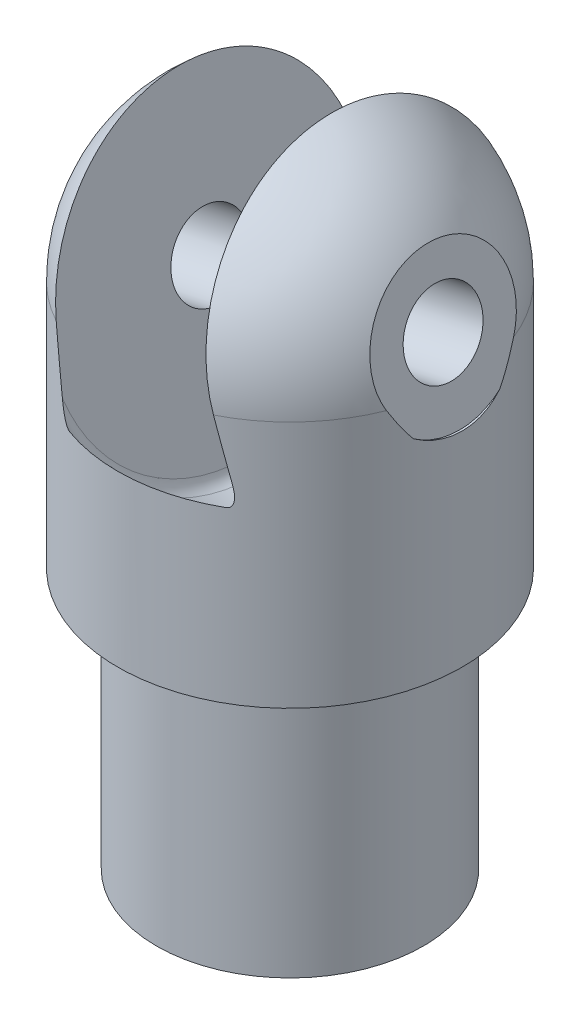
from build123d import *

# Parameters (mm, degrees)
SKETCH1_R                     = 12.9921
BOSS_EXTRUDE1_DEPTH           = 25.4
CUT_EXTRUDE1_DEPTH            = 104.344307451
CUT_EXTRUDE1_DEPTH_BACK       = 104.344307451
SKETCH3_R                     = 3.81
CUT_REVOLVE10_ANGLE           = 90
CUT_REVOLVE10_OTHER_WAY_ANGLE = 180
CUT_EXTRUDE4_DEPTH            = 32.004
FILLET1_R                     = 1.27
SKETCH15_R                    = 7.62
CUT_EXTRUDE5_DEPTH            = 10.16


with BuildPart() as part:
    # Sketch1 → Boss-Extrude1 (new body)
    with BuildSketch(Plane(origin=(0, 0, 0), x_dir=(1, 0, 0), z_dir=(0, 1, 0))):
        Circle(SKETCH1_R)
    extrude(amount=BOSS_EXTRUDE1_DEPTH)

    # Sketch2 → Revolve1 (revolve)
    with BuildSketch(Plane(origin=(0, 0, 0), x_dir=(0, 0, -1), z_dir=(1, 0, 0))):
        with BuildLine():
            Line((-16.764, 25.4), (-16.764, 49.53))
            ThreePointArc((-16.764, 49.53), (-11.85393808, 61.38393808), (0, 66.294))
            Line((0, 66.294), (0, 25.4))
            Line((0, 25.4), (-16.764, 25.4))
        make_face()
    revolve(axis=Axis((0, 25.4, 0), (0, 1, 0)))

    # Sketch3 → Cut-Extrude1 (cut, two sides: drawn at the far end of the back side and taken through both)
    with BuildSketch(Plane(origin=(-10.366451402, 98.300319395, 0), x_dir=(0, 0, -1), z_dir=(-0.9781476007338062, -0.20791169081775643, 0)).offset(-CUT_EXTRUDE1_DEPTH_BACK)):
        with Locations((0, 49.859877342)):
            Circle(SKETCH3_R)
    extrude(amount=CUT_EXTRUDE1_DEPTH + CUT_EXTRUDE1_DEPTH_BACK, mode=Mode.SUBTRACT)

    # Sketch11 → Cut-Revolve10 (revolve, cut)
    with BuildSketch(Plane.XY):
        with BuildLine():
            Line((-7.701934208, 47.892903347), (-11.162976054, 64.175825024))
            ThreePointArc((-11.162976054, 64.175825024), (-4.101170935, 67.482510185), (3.695979409, 67.570287171))
            Line((3.695979409, 67.570287171), (7.205035227, 51.061477515))
            Line((7.205035227, 51.061477515), (-7.701934208, 47.892903347))
        make_face()
    revolve(axis=Axis((17.487516564, 53.247086393, 0), (-0.9781476007338064, -0.2079116908177564, 0)), revolution_arc=CUT_REVOLVE10_ANGLE, mode=Mode.SUBTRACT)

    # Sketch11 → Cut-Revolve10 other way (revolve, cut)
    with BuildSketch(Plane.XY):
        with BuildLine():
            Line((-7.701934208, 47.892903347), (-11.162976054, 64.175825024))
            ThreePointArc((-11.162976054, 64.175825024), (-4.101170935, 67.482510185), (3.695979409, 67.570287171))
            Line((3.695979409, 67.570287171), (7.205035227, 51.061477515))
            Line((7.205035227, 51.061477515), (-7.701934208, 47.892903347))
        make_face()
    revolve(axis=Axis((17.487516564, 53.247086393, 0), (0.9781476007338064, 0.2079116908177564, 0)), revolution_arc=CUT_REVOLVE10_OTHER_WAY_ANGLE, mode=Mode.SUBTRACT)

    # Sketch13 → Cut-Revolve11 (revolve, cut)
    with BuildSketch(Plane.XY):
        with BuildLine():
            Line((-8.49407775, 51.619645705), (6.412891685, 54.788219873))
            Line((6.412891685, 54.788219873), (2.927360083, 71.186356794))
            ThreePointArc((2.927360083, 71.186356794), (-4.869286819, 71.216520857), (-11.979609352, 68.017782626))
            Line((-11.979609352, 68.017782626), (-8.49407775, 51.619645705))
        make_face()
    revolve(axis=Axis((-8.49407775, 51.619645705, 0), (0.9781476007338064, 0.2079116908177564, 0)), mode=Mode.SUBTRACT)

    # Sketch14 → Cut-Extrude4 (cut)
    with BuildSketch(Plane.XY):
        with BuildLine():
            Line((-7.701934208, 47.892903347), (-6.149656223, 40.590009601))
            ThreePointArc((-6.149656223, 40.590009601), (1.969552427, 39.042311826), (8.757313212, 43.758583769))
            Line((8.757313212, 43.758583769), (7.205035227, 51.061477515))
            Line((7.205035227, 51.061477515), (-7.701934208, 47.892903347))
        make_face()
    extrude(amount=-CUT_EXTRUDE4_DEPTH, mode=Mode.SUBTRACT)

    # Fillet1
    fillet1_edges = [part.edges().sort_by_distance(p)[0] for p in [
        (-4.840027967, 34.428693074, 9.361457334),
        (-5.306564153, 36.623573262, -6.782727573),
        (-6.149656223, 40.590009601, -14.000445211),
        (8.757313212, 43.758583769, -13.350191985),
        (9.600405282, 39.79214743, -6.782727573),
        (10.298585015, 36.507470038, 7.966497668),
    ]]
    fillet(fillet1_edges, radius=FILLET1_R)

    # Sketch15 → Cut-Extrude5 (cut)
    with BuildSketch(Plane(origin=(-4.834136469, -1.027527427, 0), x_dir=(0, 0, -1), z_dir=(-0.9781476007338062, -0.20791169081775643, 0))):
        with Locations((0, -48.447650664)):
            Circle(SKETCH15_R)
    cut_extrude5 = extrude(amount=CUT_EXTRUDE5_DEPTH, mode=Mode.SUBTRACT)

    # Mirror1: Cut-Extrude5 across plane
    add(cut_extrude5.mirror(Plane(origin=(10.072832966, 2.141046741, 0), x_dir=(0, 0, 1), z_dir=(-0.9781476007338062, -0.20791169081775643, 0))), mode=Mode.SUBTRACT)


solid = part.part
